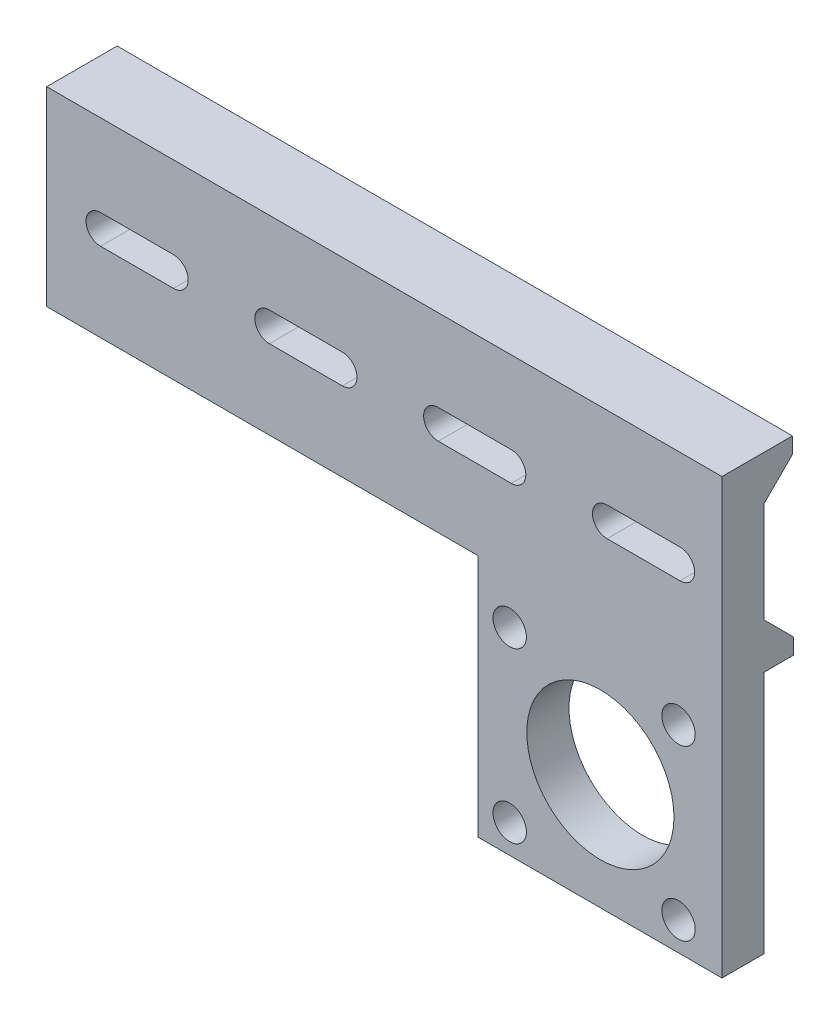
from build123d import *

# Parameters (mm, degrees)
SKETCH2_W            = 57.841668917
SKETCH2_H            = 57.763290133
BOSS_EXTRUDE2_DEPTH  = 10
SKETCH3_R            = 17.437880415
CUT_EXTRUDE1_DEPTH   = 10
SKETCH4_R            = 3.955692903
CUT_EXTRUDE2_DEPTH   = 10
LPATTERN1_COUNT      = 2
LPATTERN1_PITCH      = 40
LPATTERN1_COUNT_DIR2 = 2
LPATTERN1_PITCH_DIR2 = 40
BOSS_EXTRUDE3_DEPTH  = 160
CUT_EXTRUDE4_DEPTH   = 140
LPATTERN3_COUNT      = 4
LPATTERN3_PITCH      = 40


with BuildPart() as part:
    # Sketch2 → Boss-Extrude2 (new body)
    with BuildSketch(Plane.XY.offset(40)):
        with Locations((-29.483550841, 6.552722843)):
            Rectangle(SKETCH2_W, SKETCH2_H)
    extrude(amount=BOSS_EXTRUDE2_DEPTH)

    # Sketch3 → Cut-Extrude1 (cut)
    with BuildSketch(Plane.XY.offset(50)):
        with Locations((-29.375544169, 4.96557555)):
            Circle(SKETCH3_R)
    extrude(amount=-CUT_EXTRUDE1_DEPTH, mode=Mode.SUBTRACT)

    # Sketch4 → Cut-Extrude2 (cut)
    with BuildSketch(Plane.XY.offset(50)):
        with Locations((-50.863076756, -15.54525101)):
            Circle(SKETCH4_R)
    cut_extrude2 = extrude(amount=-CUT_EXTRUDE2_DEPTH, mode=Mode.SUBTRACT)

    # LPattern1: Cut-Extrude2 2 × 2
    with Locations(*[(j * LPATTERN1_PITCH_DIR2, i * LPATTERN1_PITCH, 0) for i in range(LPATTERN1_COUNT) for j in range(LPATTERN1_COUNT_DIR2) if (i, j) != (0, 0)]):
        add(cut_extrude2, mode=Mode.SUBTRACT)

    # Sketch6 → Boss-Extrude3 (add)
    with BuildSketch(Plane(origin=(-0.562716382, 0, 0), x_dir=(0, 0, -1), z_dir=(1, 0, 0))):
        Polygon((-50, 35.43436791), (-33.10474998, 35.43436791), (-33.10474998, 39.232903218), (-40, 46.128153238), (-40, 70.072245269), (-33.308662667, 76.763582602), (-33.308662667, 80.56211791), (-50, 80.56211791), align=None)
    extrude(amount=-BOSS_EXTRUDE3_DEPTH)

    # Sketch7 → Cut-Extrude4 (cut)
    with BuildSketch(Plane.XY.offset(50)):
        with BuildLine():
            Line((-147.793733914, 61.1224407), (-130.505757977, 61.1224407))
            ThreePointArc((-130.505757977, 61.1224407), (-127.044160944, 57.660843667), (-130.505757977, 54.199246633))
            Line((-130.505757977, 54.199246633), (-147.793733914, 54.199246633))
            ThreePointArc((-147.793733914, 54.199246633), (-151.255330948, 57.660843667), (-147.793733914, 61.1224407))
        make_face()
    cut_extrude4 = extrude(amount=-CUT_EXTRUDE4_DEPTH, mode=Mode.SUBTRACT)

    # LPattern3: Cut-Extrude4 ×4
    with Locations(*[(i * LPATTERN3_PITCH, 0, 0) for i in range(1, LPATTERN3_COUNT)]):
        add(cut_extrude4, mode=Mode.SUBTRACT)


solid = part.part
